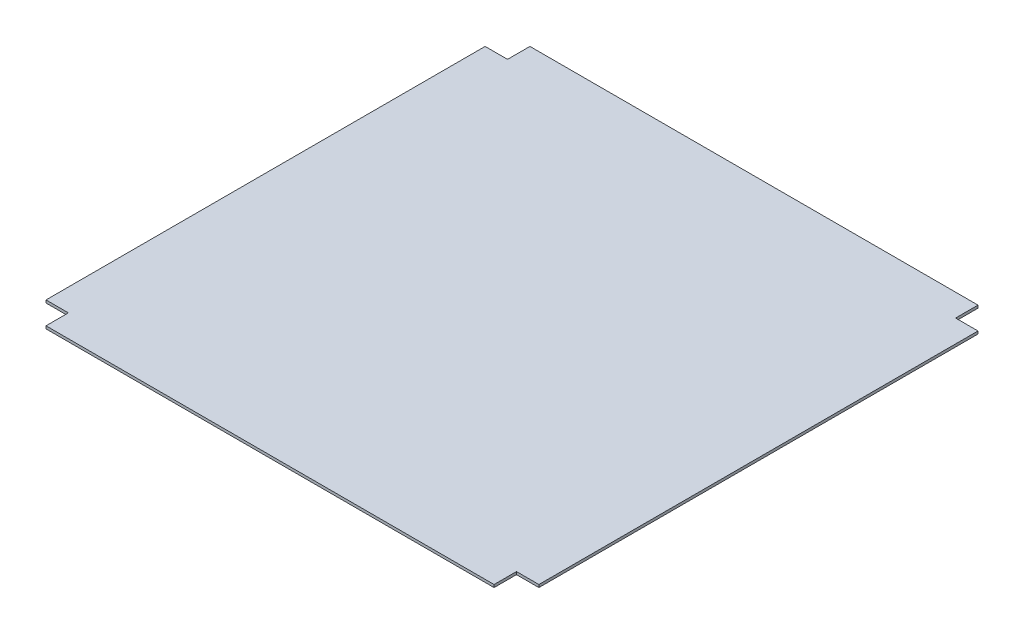
from build123d import *

# Parameters (mm, degrees)
BASE_FLANGE1_DEPTH = 3


# Sheet-metal steps are written as plain solids
with BuildPart() as part:
    # Sketch1 → Base-Flange1 (new body)
    with BuildSketch(Plane(origin=(0, 0, 0), x_dir=(1, 0, 0), z_dir=(0, 1, 0))):
        Polygon((250, 270), (250, 245), (275, 245), (275, -245), (250, -245), (250, -270), (-250, -270), (-250, -245), (-275, -245), (-275, 245), (-250, 245), (-250, 270), align=None)
    extrude(amount=-BASE_FLANGE1_DEPTH)


solid = part.part
